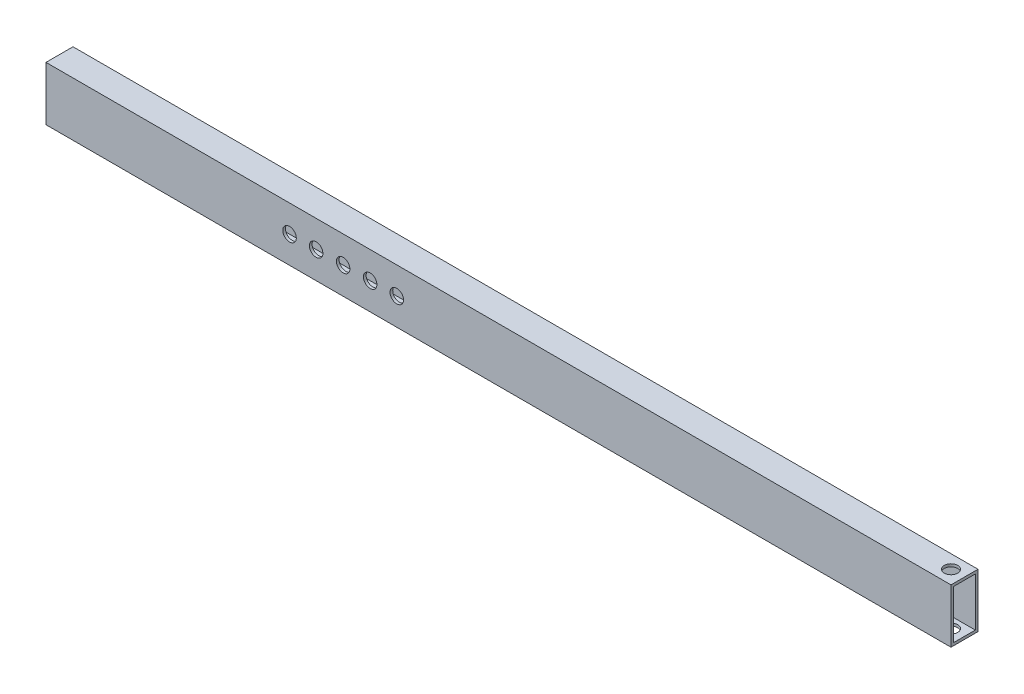
from build123d import *

# Parameters (mm, degrees)
BOSS_EXTRUDE1_DEPTH      = 225
BOSS_EXTRUDE1_DEPTH_BACK = 110
SKETCH1_W                = 10
SKETCH1_H                = 20
SKETCH1_W_2              = 8
SKETCH1_H_2              = 18
SKETCH2_R                = 2.5
CUT_EXTRUDE1_DEPTH       = 1
SKETCH3_R                = 2.5
CUT_EXTRUDE2_DEPTH       = 20


with BuildPart() as part:
    # Sketch1 → Boss-Extrude1 (new, two sides: drawn at the far end of the back side and taken through both)
    with BuildSketch(Plane(origin=(0, 0, 0), x_dir=(0, 0, -1), z_dir=(1, 0, 0)).offset(-BOSS_EXTRUDE1_DEPTH_BACK)):
        Rectangle(SKETCH1_W, SKETCH1_H)
        Rectangle(SKETCH1_W_2, SKETCH1_H_2, mode=Mode.SUBTRACT)
    extrude(amount=BOSS_EXTRUDE1_DEPTH + BOSS_EXTRUDE1_DEPTH_BACK)

    # Sketch2 → Cut-Extrude1 (cut)
    with BuildSketch(Plane.XY.offset(5)):
        with Locations((-19.85, 0)):
            Circle(SKETCH2_R)
        with Locations((-10, 0)):
            Circle(SKETCH2_R)
        Circle(SKETCH2_R)
        with Locations((19.85, 0)):
            Circle(SKETCH2_R)
        with Locations((10, 0)):
            Circle(SKETCH2_R)
    extrude(amount=-CUT_EXTRUDE1_DEPTH, mode=Mode.SUBTRACT)

    # Sketch3 → Cut-Extrude2 (cut)
    with BuildSketch(Plane(origin=(0, 10, 0), x_dir=(1, 0, 0), z_dir=(0, 1, 0))):
        with Locations((220, 0)):
            Circle(SKETCH3_R)
    extrude(amount=-CUT_EXTRUDE2_DEPTH, mode=Mode.SUBTRACT)


solid = part.part
